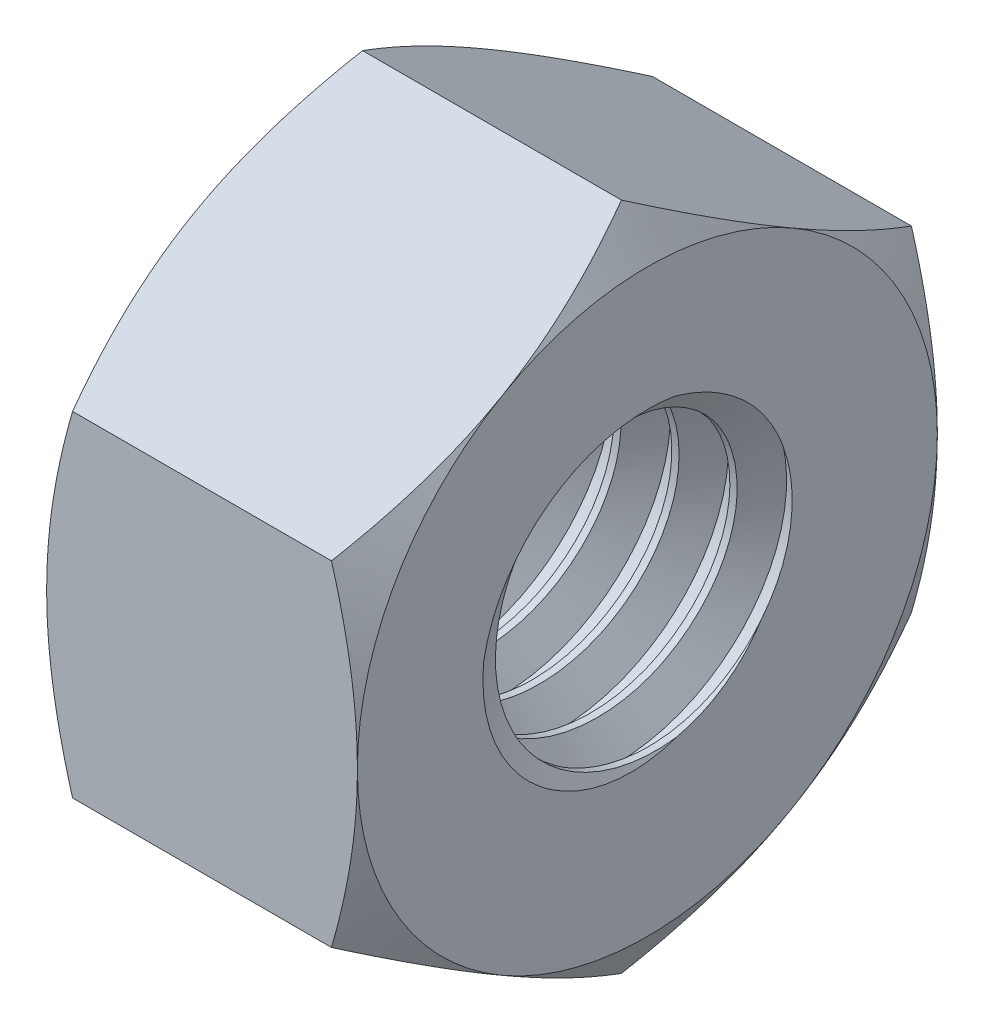
from build123d import *

# Parameters (mm, degrees)
SKETCH2_OUTSIDE_W  = 12.488
SKETCH2_OUTSIDE_H  = 12.488
CUT_EXTRUDE1_DEPTH = 7.835873512
THREAD1_PITCH      = 0.7


with BuildPart() as part:
    # Sketch1 → Revolve1 (revolve)
    with BuildSketch(Plane.XY, mode=Mode.PRIVATE) as revolve1_sk:
        Polygon((-1.562392609, 4.041451884), (-1.875, 3.5), (-1.875, 1.63), (1.875, 1.63), (1.875, 3.5), (1.562392609, 4.041451884), align=None)
    revolve(revolve1_sk.sketch.rotate(Axis((-1.875, 0, 0), (1, 0, 0)), 90), axis=Axis((-1.875, 0, 0), (1, 0, 0)))

    # Sketch2 outside → Cut-Extrude1 (cut, through all)
    with BuildSketch(Plane(origin=(1.875, 0, 0), x_dir=(0, 0, -1), z_dir=(1, 0, 0))):
        Rectangle(SKETCH2_OUTSIDE_W, SKETCH2_OUTSIDE_H)
        Polygon((0, 4.041451884), (-3.5, 2.020725942), (-3.5, -2.020725942), (0, -4.041451884), (3.5, -2.020725942), (3.5, 2.020725942), align=None, mode=Mode.SUBTRACT)
    extrude(amount=-CUT_EXTRUDE1_DEPTH, mode=Mode.SUBTRACT)

    # Thread1: the profile of Thread Profile1 profile screwed along a right-hand helix of 6.785714 turns, 6 arcs to a turn; built about Z, then put on its axis
    thread1_z = Axis((0, 0, 0), (0, 0, 1))
    thread1_corners = [(1.6297, 0, -0.000173205), (1.6297, 0, 0.612673203), (2.008886112, 0, 0.393749999), (2.008886112, 0, 0.218749999)]
    with BuildLine(mode=Mode.PRIVATE) as thread1_profile:
        Line(thread1_corners[0], thread1_corners[1])
        Line(thread1_corners[1], thread1_corners[2])
        Line(thread1_corners[2], thread1_corners[3])
        Line(thread1_corners[3], thread1_corners[0])
    thread1_cap = Face(thread1_profile.wire())
    thread1_turn_angles = [0, 30, 60, 90, 120, 150, 180, 210, 240, 270, 300, 330, 360]
    thread1_turn_weights = [1, 0.8660254037844387, 1, 0.8660254037844387, 1, 0.8660254037844387, 1, 0.8660254037844387, 1, 0.8660254037844387, 1, 0.8660254037844387, 1]
    thread1_turn_rails = [Edge.make_bspline([Vector(p[0], p[1], 0).rotate(thread1_z, thread1_turn_angles[k]) / thread1_turn_weights[k] + Vector(0, 0, p[2] + THREAD1_PITCH * thread1_turn_angles[k] / 360) for k in range(13)], [0, 0, 0, 1, 1, 2, 2, 3, 3, 4, 4, 5, 5, 6, 6, 6], 2, thread1_turn_weights) for p in thread1_corners]
    thread1_turn_sides = [Face.make_surface_from_curves(thread1_turn_rails[p[0]], thread1_turn_rails[p[1]]) for p in [(0, 1), (1, 2), (2, 3), (3, 0)]]
    thread1_last_angles = [2160, 2190, 2220, 2250, 2280, 2310, 2340, 2370, 2400, 2421.428571429, 2442.857142857]
    thread1_last_weights = [1, 0.8660254037844387, 1, 0.8660254037844387, 1, 0.8660254037844387, 1, 0.8660254037844387, 1, 0.9308737486442035, 1]
    thread1_last_rails = [Edge.make_bspline([Vector(p[0], p[1], 0).rotate(thread1_z, thread1_last_angles[k]) / thread1_last_weights[k] + Vector(0, 0, p[2] + THREAD1_PITCH * thread1_last_angles[k] / 360) for k in range(11)], [0, 0, 0, 1, 1, 2, 2, 3, 3, 4, 4, 5, 5, 5], 2, thread1_last_weights) for p in thread1_corners]
    thread1_last_sides = [Face.make_surface_from_curves(thread1_last_rails[p[0]], thread1_last_rails[p[1]]) for p in [(0, 1), (1, 2), (2, 3), (3, 0)]]
    thread1 = Plane(origin=(-2.875, 0, 0), x_dir=(0, 0, -1), z_dir=(1, 0, 0)) * Solid(Shell([*[p.moved(Location((0, 0, THREAD1_PITCH * i))) for i in range(6) for p in thread1_turn_sides], *thread1_last_sides, thread1_cap, thread1_cap.rotate(thread1_z, 2442.857142857).moved(Location((0, 0, THREAD1_PITCH * 2442.857142857 / 360)))]))
    add(thread1, mode=Mode.SUBTRACT)


solid = part.part
